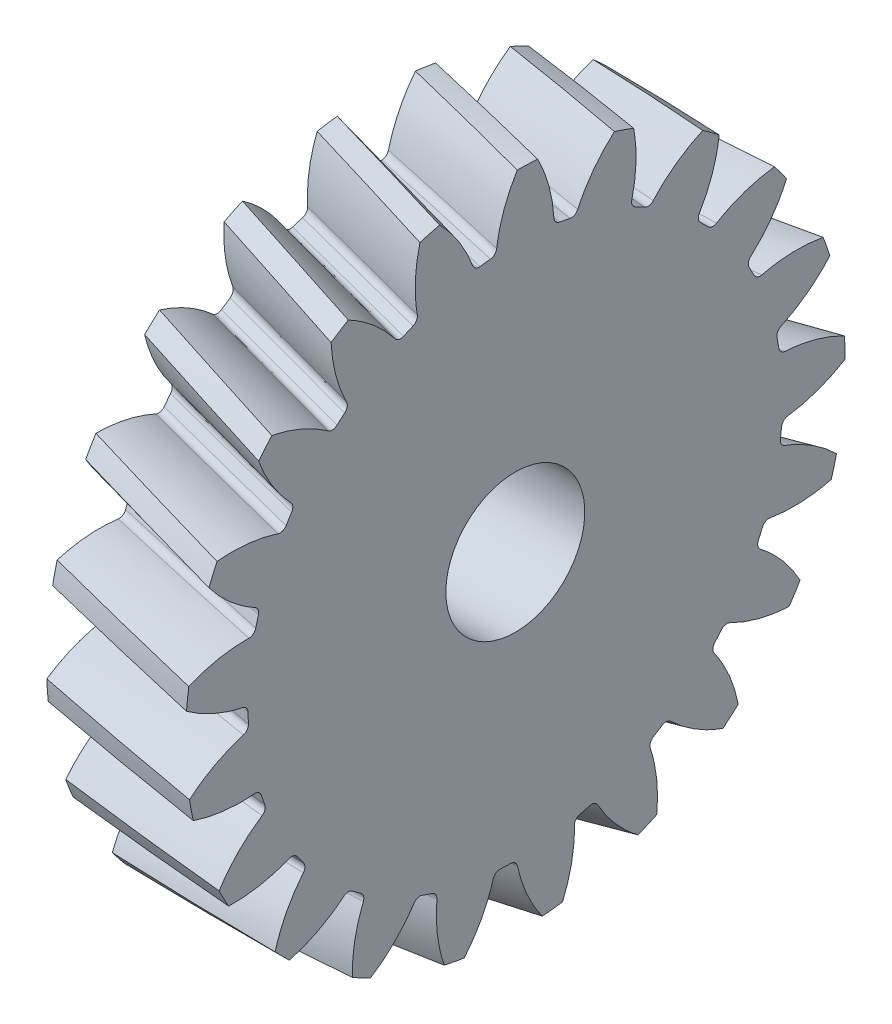
from build123d import *

# Parameters (mm, degrees)
BASPROSKE_W            = 5
BASPROSKE_H            = 11.870399894
TOOTHCUTRH_PITCH       = 278.350987101
TOOTHCUTRH_HEIGHT      = 5
TOOTHCUTRH_RADIUS      = 11.870399894
TOOTHCUTRH_START_ANGLE = -90
TEETHCUTSRH_COUNT      = 21
TEETHCUTSRH_ANGLE      = 342.857142857
BORSKE_R               = 2.5
BORE_DEPTH             = 62.5000025


with BuildPart() as part:
    # BasProSke → Base-Revolve (revolve)
    with BuildSketch(Plane(origin=(0, 0, 0), x_dir=(1, 0, 0), z_dir=(0, 1, 0)), mode=Mode.PRIVATE) as base_revolve_sk:
        with Locations((2.5, 5.935199947)):
            Rectangle(BASPROSKE_W, BASPROSKE_H)
    revolve(base_revolve_sk.sketch.rotate(Axis((-10, 0, 0), (1, 0, 0)), 180), axis=Axis((-10, 0, 0), (1, 0, 0)))

    # ToothCutRH: sweep along a helix
    with BuildLine() as toothcutrh_path:
        add(Helix(TOOTHCUTRH_PITCH, TOOTHCUTRH_HEIGHT, TOOTHCUTRH_RADIUS, center=(0, 0, 0), direction=(1, 0, 0), mode=Mode.PRIVATE).rotate(Axis((0, 0, 0), (1, 0, 0)), TOOTHCUTRH_START_ANGLE))
    # TooCutSkeRH → ToothCutRH (sweep, cut)
    with BuildSketch(Plane(origin=(0, 0, 0), x_dir=(0, 0, -1), z_dir=(1, 0, 0))):
        with BuildLine():
            ThreePointArc((0.187600664, 9.618570586), (0, 9.620399894), (-0.187600664, 9.618570586))
            ThreePointArc((-0.187600664, 9.618570586), (-0.345073694, 9.670222043), (-0.436029318, 9.808759774))
            ThreePointArc((-0.436029318, 9.808759774), (-0.913637647, 11.038399188), (-1.682685813, 12.11016769))
            ThreePointArc((-1.682685813, 12.11016769), (0, 12.226511891), (1.682685813, 12.11016769))
            ThreePointArc((1.682685813, 12.11016769), (0.913637647, 11.038399188), (0.436029318, 9.808759774))
            ThreePointArc((0.436029318, 9.808759774), (0.345073694, 9.670222043), (0.187600664, 9.618570586))
        make_face()
    toothcutrh = sweep(path=toothcutrh_path.line, is_frenet=True, mode=Mode.SUBTRACT)

    # TeethCutsRH: ToothCutRH ×21 about axis
    teethcutsrh_axis = Axis((-10, 0, 0), (1, 0, 0))
    for i in range(1, TEETHCUTSRH_COUNT):
        add(toothcutrh.rotate(teethcutsrh_axis, i * TEETHCUTSRH_ANGLE / (TEETHCUTSRH_COUNT - 1)), mode=Mode.SUBTRACT)

    # BorSke → Bore (cut, symmetric)
    with BuildSketch(Plane(origin=(0, 0, 0), x_dir=(0, 0, -1), z_dir=(1, 0, 0))):
        with Locations(Location((0, 0, 0), (0, 0, 180))):
            Circle(BORSKE_R)
    extrude(amount=BORE_DEPTH, both=True, mode=Mode.SUBTRACT)


solid = part.part
